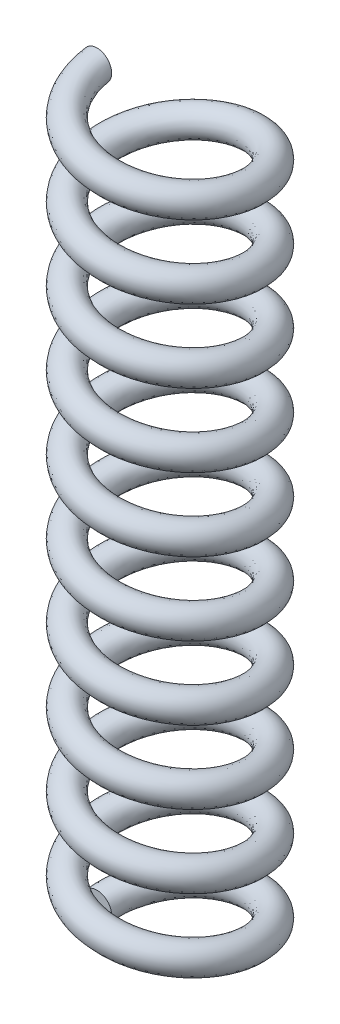
from build123d import *

# Parameters (mm, degrees)
BALAYAGE2_PITCH       = 10
BALAYAGE2_HEIGHT      = 100
BALAYAGE2_RADIUS      = 10
BALAYAGE2_START_ANGLE = -90
ESQUISSE4_R           = 2


with BuildPart() as part:
    # Balayage2: sweep along a helix
    with BuildLine() as balayage2_path:
        add(Helix(BALAYAGE2_PITCH, BALAYAGE2_HEIGHT, BALAYAGE2_RADIUS, center=(0, 0, 0), direction=(0, 1, 0), lefthand=True, mode=Mode.PRIVATE).rotate(Axis((0, 0, 0), (0, 1, 0)), BALAYAGE2_START_ANGLE))
    # Esquisse4 → Balayage2 (sweep)
    with BuildSketch(Plane.XY):
        with Locations((-10, 0)):
            Circle(ESQUISSE4_R)
    sweep(path=balayage2_path.line, is_frenet=True)


solid = part.part
